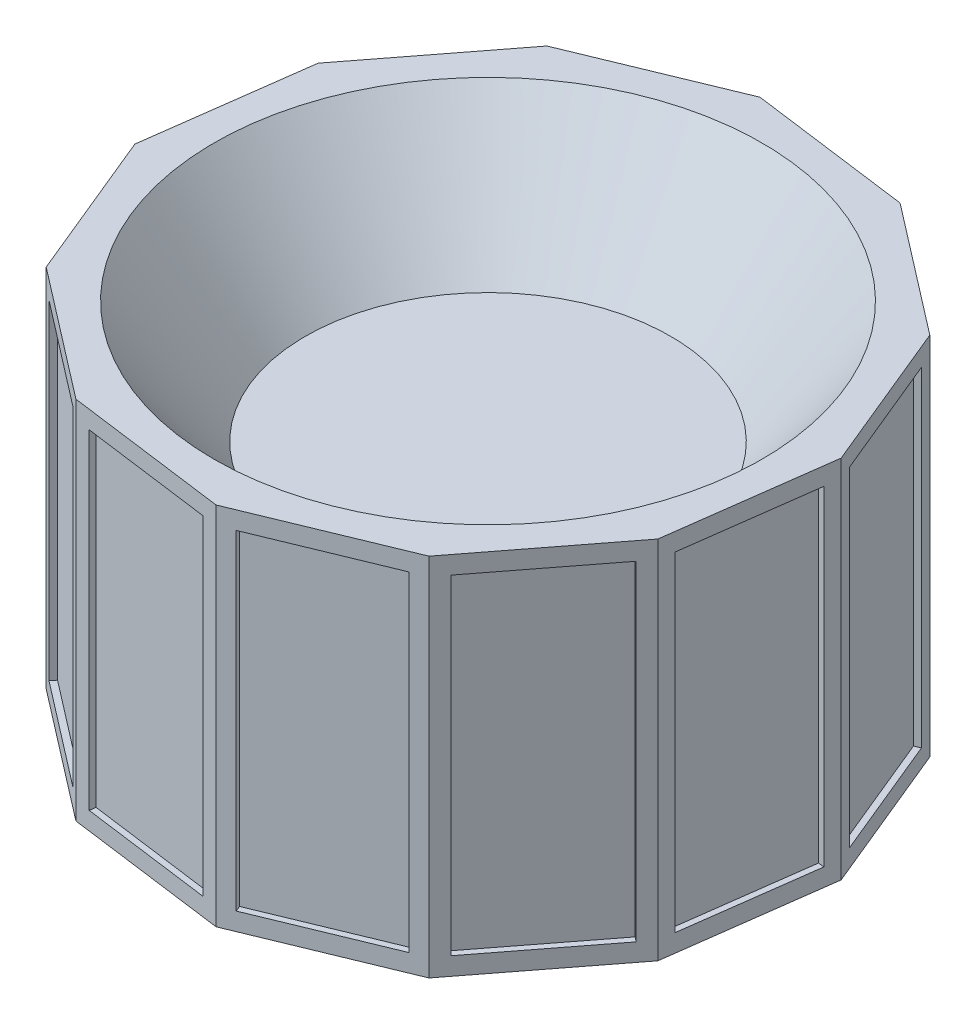
from build123d import *

# Parameters (mm, degrees)
SKETCH_1_R               = 90
SKETCH_1_R_2             = 50
EXTRUDE_1_DEPTH          = 50
SKETCH_5_R               = 150
EXTRUDE_2_DEPTH          = 100
SKETCH_6_R               = 150
SKETCH_8_R               = 225
CUT_EXTRUDE_1_DEPTH      = 5
PATTERN_CIRCULAR_1_COUNT = 12


with BuildPart() as part:
    # 草图1 → 凸台-拉伸1 (new, symmetric)
    with BuildSketch(Plane(origin=(0, -1025, 0), x_dir=(-1, 0, 0), z_dir=(0, 1, 0))):
        with Locations(Location((0, 0, 0), (0, 0, 90))):
            Circle(SKETCH_1_R)
        with Locations(Location((0, 0, 0), (0, 0, 90))):
            Circle(SKETCH_1_R_2, mode=Mode.SUBTRACT)
    extrude(amount=EXTRUDE_1_DEPTH, both=True)

    # 草图5 → 凸台-拉伸2 (add)
    with BuildSketch(Plane(origin=(0, -975, 0), x_dir=(-1, 0, 0), z_dir=(0, 1, 0))):
        with Locations(Location((0, 0, 0), (0, 0, 90))):
            Circle(SKETCH_5_R)
    extrude(amount=-EXTRUDE_2_DEPTH)

    # 凸台-拉伸4: read off the stored shape, not the designer's step
    # 凸台-拉伸4: loft between two sections, ruled curve by curve
    extrude_4_from = [
        Edge.make_line((-33.353210676, -1175, -256.660985437), (-157.215220461, -1175, -205.598328211)),
        Edge.make_line((-157.215220461, -1175, -205.598328211), (-238.951538886, -1175, -99.445764975)),
        Edge.make_line((-238.951538886, -1175, -99.445764975), (-256.660985437, -1175, 33.353210676)),
        Edge.make_line((-256.660985437, -1175, 33.353210676), (-205.598328211, -1175, 157.215220461)),
        Edge.make_line((-205.598328211, -1175, 157.215220461), (-99.445764975, -1175, 238.951538886)),
        Edge.make_line((-99.445764975, -1175, 238.951538886), (33.353210676, -1175, 256.660985437)),
        Edge.make_line((33.353210676, -1175, 256.660985437), (157.215220461, -1175, 205.598328211)),
        Edge.make_line((157.215220461, -1175, 205.598328211), (238.951538886, -1175, 99.445764975)),
        Edge.make_line((238.951538886, -1175, 99.445764975), (256.660985437, -1175, -33.353210676)),
        Edge.make_line((256.660985437, -1175, -33.353210676), (205.598328211, -1175, -157.215220461)),
        Edge.make_line((205.598328211, -1175, -157.215220461), (99.445764975, -1175, -238.951538886)),
        Edge.make_line((99.445764975, -1175, -238.951538886), (-33.353210676, -1175, -256.660985437)),
    ]
    extrude_4_to = [
        Edge.make_line((-33.353210676, -875, -256.660985437), (-157.215220461, -875, -205.598328211)),
        Edge.make_line((-157.215220461, -875, -205.598328211), (-238.951538886, -875, -99.445764975)),
        Edge.make_line((-238.951538886, -875, -99.445764975), (-256.660985437, -875, 33.353210676)),
        Edge.make_line((-256.660985437, -875, 33.353210676), (-205.598328211, -875, 157.215220461)),
        Edge.make_line((-205.598328211, -875, 157.215220461), (-99.445764975, -875, 238.951538886)),
        Edge.make_line((-99.445764975, -875, 238.951538886), (33.353210676, -875, 256.660985437)),
        Edge.make_line((33.353210676, -875, 256.660985437), (157.215220461, -875, 205.598328211)),
        Edge.make_line((157.215220461, -875, 205.598328211), (238.951538886, -875, 99.445764975)),
        Edge.make_line((238.951538886, -875, 99.445764975), (256.660985437, -875, -33.353210676)),
        Edge.make_line((256.660985437, -875, -33.353210676), (205.598328211, -875, -157.215220461)),
        Edge.make_line((205.598328211, -875, -157.215220461), (99.445764975, -875, -238.951538886)),
        Edge.make_line((99.445764975, -875, -238.951538886), (-33.353210676, -875, -256.660985437)),
    ]
    extrude_4 = Solid(Shell([*[Face.make_surface_from_curves(extrude_4_from[k], extrude_4_to[k]) for k in range(12)], Face(Wire(extrude_4_from)), Face(Wire(extrude_4_to))]))
    add(extrude_4)

    # 草图6 → 切除-放样3 section 0
    with BuildSketch(Plane(origin=(0, -1075, 0), x_dir=(-1, 0, 0), z_dir=(0, 1, 0))):
        Circle(SKETCH_6_R)
    # 草图8 → 切除-放样3 section 1
    with BuildSketch(Plane(origin=(0, -1175, 0), x_dir=(-1, 0, 0), z_dir=(0, 1, 0))):
        Circle(SKETCH_8_R)
    loft_3 = loft(mode=Mode.SUBTRACT)

    # 镜向2: 切除-放样3 across plane
    add(loft_3.mirror(Plane.ZX.offset(-1025)), mode=Mode.SUBTRACT)

    # 草图9 → 切除-拉伸1 (cut)
    with BuildSketch(Plane(origin=(231.129656824, 0, -95.284215569), x_dir=(-0.3811368622740284, 0, -0.9245186272952581), z_dir=(0.9245186272952581, 0, -0.3811368622740284))):
        Polygon((-54.297116462, -889.659578346), (-54.297116462, -1146.583758404), (54.297116462, -903.416241596), (54.297116462, -889.659578346), align=None)
        Polygon((54.297116462, -903.416241596), (-54.297116462, -1146.583758404), (-54.297116462, -1160.340421654), (54.297116462, -1160.340421654), align=None)
    cut_extrude_1 = extrude(amount=-CUT_EXTRUDE_1_DEPTH, mode=Mode.SUBTRACT)

    # 阵列(圆周)1: 切除-拉伸1 ×12 about axis
    pattern_circular_1_axis = Axis((0, 0, 0), (0, 1, 0))
    for i in range(1, PATTERN_CIRCULAR_1_COUNT):
        add(cut_extrude_1.rotate(pattern_circular_1_axis, i * 360 / PATTERN_CIRCULAR_1_COUNT), mode=Mode.SUBTRACT)


solid = part.part
